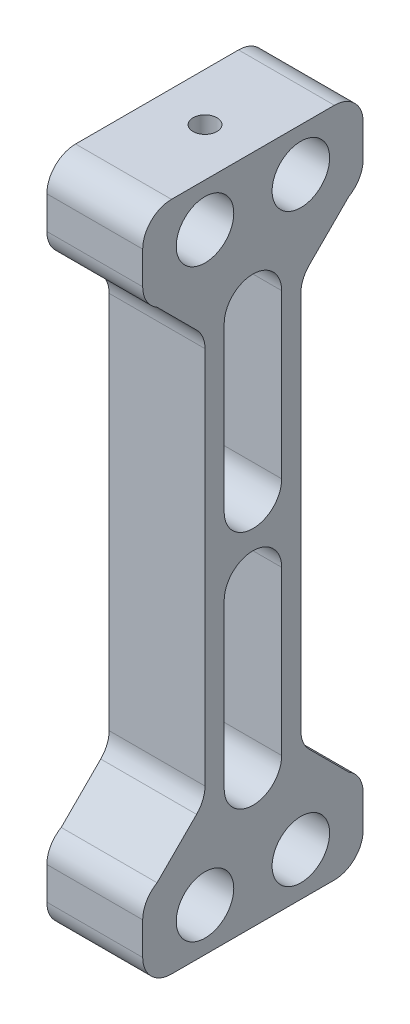
from build123d import *

# Parameters (mm, degrees)
SKETCH1_R                       = 3
BOSS_EXTRUDE1_DEPTH             = 10
CHAMFER1_SIZE                   = 5
FILLET1_R                       = 3
M3_TAPPED_HOLE3_D               = 2.5
M3_TAPPED_HOLE3_DEPTH           = 7.5
M3_TAPPED_HOLE3_TIP             = 0.751075774
M3_TAPPED_HOLE3_ON_FACE_2_D     = 2.5
M3_TAPPED_HOLE3_ON_FACE_2_DEPTH = 7.5
M3_TAPPED_HOLE3_ON_FACE_2_TIP   = 0.751075774


with BuildPart() as part:
    # Sketch1 → Boss-Extrude1 (new body)
    with BuildSketch(Plane(origin=(0, 0, 0), x_dir=(0, 0, -1), z_dir=(1, 0, 0))):
        Polygon((-16.5, 65.5), (-16.5, 56.5), (-10, 56.5), (-10, 4.5), (-16.5, 4.5), (-16.5, -4.5), (6.5, -4.5), (6.5, 4.5), (0, 4.5), (0, 56.5), (6.5, 56.5), (6.5, 65.5), align=None)
        with Locations((-10, 0)):
            Circle(SKETCH1_R, mode=Mode.SUBTRACT)
        with BuildLine():
            ThreePointArc((-8, 26.5), (-5, 29.5), (-2, 26.5))
            Line((-2, 26.5), (-2, 9.5))
            ThreePointArc((-2, 9.5), (-5, 6.5), (-8, 9.5))
            Line((-8, 9.5), (-8, 26.5))
        make_face(mode=Mode.SUBTRACT)
        Circle(SKETCH1_R, mode=Mode.SUBTRACT)
        with BuildLine():
            Line((-2, 51.5), (-2, 34.5))
            ThreePointArc((-2, 34.5), (-5, 31.5), (-8, 34.5))
            Line((-8, 34.5), (-8, 51.5))
            ThreePointArc((-8, 51.5), (-5, 54.5), (-2, 51.5))
        make_face(mode=Mode.SUBTRACT)
        with Locations((-10, 61)):
            Circle(SKETCH1_R, mode=Mode.SUBTRACT)
        with Locations((0, 61)):
            Circle(SKETCH1_R, mode=Mode.SUBTRACT)
    extrude(amount=BOSS_EXTRUDE1_DEPTH)

    # Chamfer1
    chamfer1_edges = [part.edges().sort_by_distance(p)[0] for p in [
        (5, 4.5, 10),
        (5, 56.5, 10),
        (5, 56.5, 0),
        (5, 4.5, 0),
    ]]
    chamfer(chamfer1_edges, length=CHAMFER1_SIZE)

    # Fillet1
    # the kernel refuses this fillet: 3 mm, written as the material it adds along each edge
    with BuildSketch(Plane(origin=(0, 51.5, 0), x_dir=(0, 0.7071067811865468, -0.7071067811865482), z_dir=(1, 0, 0)), Plane(origin=(0, 9.5, 0), x_dir=(0, 1, 0), z_dir=(1, 0, 0))) as fillet1_piece_1:
        with BuildLine():
            CenterArc((FILLET1_R * 0.414213562373, -FILLET1_R), FILLET1_R, 90, 45)
            Line((-FILLET1_R * 0.292893218813, -FILLET1_R * 0.292893218813), (0, 0))
            Line((0, 0), (FILLET1_R * 0.414213562373, 0))
        make_face()
    extrude(amount=10)
    with BuildSketch(Plane(origin=(0, 9.5, 10), x_dir=(0, 1, 0), z_dir=(1, 0, 0)), Plane(origin=(0, 51.5, 10), x_dir=(0, 0.7071067811865468, 0.7071067811865482), z_dir=(1, 0, 0))) as fillet1_piece_2:
        with BuildLine():
            CenterArc((FILLET1_R * 0.414213562373, FILLET1_R), FILLET1_R, 225, 45)
            Line((-FILLET1_R * 0.292893218813, FILLET1_R * 0.292893218813), (0, 0))
            Line((0, 0), (FILLET1_R * 0.414213562373, 0))
        make_face()
    extrude(amount=10)
    # the kernel refuses this fillet: 3 mm, written as the material it takes off along each edge
    with BuildSketch(Plane(origin=(-6.495190528, 56.5, 16.5), x_dir=(0, 1, 0), z_dir=(1, 0, 0))) as fillet1_2_piece_1:
        with BuildLine():
            CenterArc((2.598076211, -3), FILLET1_R, 90, 60)
            Line((0, -1.5), (0, 0))
            Line((0, 0), (2.598076211, 0))
        make_face()
    extrude(amount=22.990381057, mode=Mode.SUBTRACT)
    with BuildSketch(Plane(origin=(-7.5, 65.5, 16.5), x_dir=(0, 0, -1), z_dir=(1, 0, 0)), Plane(origin=(-7.5, 65.5, -6.5), x_dir=(0, -1, 0), z_dir=(1, 0, 0))) as fillet1_2_piece_2:
        with BuildLine():
            CenterArc((FILLET1_R, -FILLET1_R), FILLET1_R, 90, 90)
            Line((0, -FILLET1_R), (0, 0))
            Line((0, 0), (FILLET1_R, 0))
        make_face()
    extrude(amount=25, mode=Mode.SUBTRACT)
    with BuildSketch(Plane(origin=(-6.495190528, 56.5, -6.5), x_dir=(0, 0, 1), z_dir=(1, 0, 0))) as fillet1_2_piece_3:
        with BuildLine():
            CenterArc((3, -2.598076211), FILLET1_R, 120, 60)
            Line((0, -2.598076211), (0, 0))
            Line((0, 0), (1.5, 0))
        make_face()
    extrude(amount=22.990381057, mode=Mode.SUBTRACT)
    with BuildSketch(Plane(origin=(-6.495190528, 4.5, -6.5), x_dir=(0, 0, 1), z_dir=(1, 0, 0))) as fillet1_2_piece_4:
        with BuildLine():
            CenterArc((3, 2.598076211), FILLET1_R, 180, 60)
            Line((0, 2.598076211), (0, 0))
            Line((0, 0), (1.5, 0))
        make_face()
    extrude(amount=22.990381057, mode=Mode.SUBTRACT)
    with BuildSketch(Plane(origin=(-7.5, -4.5, -6.5), x_dir=(0, 1, 0), z_dir=(1, 0, 0)), Plane(origin=(-7.5, -4.5, 16.5), x_dir=(0, 0, -1), z_dir=(1, 0, 0))) as fillet1_2_piece_5:
        with BuildLine():
            CenterArc((FILLET1_R, FILLET1_R), FILLET1_R, 180, 90)
            Line((0, FILLET1_R), (0, 0))
            Line((0, 0), (FILLET1_R, 0))
        make_face()
    extrude(amount=25, mode=Mode.SUBTRACT)
    with BuildSketch(Plane(origin=(-6.495190528, 4.5, 16.5), x_dir=(0, -1, 0), z_dir=(1, 0, 0))) as fillet1_2_piece_6:
        with BuildLine():
            CenterArc((2.598076211, 3), FILLET1_R, 210, 60)
            Line((0, 1.5), (0, 0))
            Line((0, 0), (2.598076211, 0))
        make_face()
    extrude(amount=22.990381057, mode=Mode.SUBTRACT)

    # M3 Tapped Hole3
    with Locations(Plane(origin=(5, 65.5, 5), x_dir=(0, 0, 1), z_dir=(0, 1, 0))):
        with Locations((0, 0)):
            Hole(M3_TAPPED_HOLE3_D / 2, depth=M3_TAPPED_HOLE3_DEPTH)
            with Locations((0, 0, -(M3_TAPPED_HOLE3_DEPTH + M3_TAPPED_HOLE3_TIP / 2))):  # 118° drill point
                Cone(0, M3_TAPPED_HOLE3_D / 2, M3_TAPPED_HOLE3_TIP, mode=Mode.SUBTRACT)

    # M3 Tapped Hole3 on face 2
    with Locations(Plane(origin=(5, -4.5, 5), x_dir=(0, 0, -1), z_dir=(0, -1, 0))):
        with Locations((0, 0)):
            Hole(M3_TAPPED_HOLE3_ON_FACE_2_D / 2, depth=M3_TAPPED_HOLE3_ON_FACE_2_DEPTH)
            with Locations((0, 0, -(M3_TAPPED_HOLE3_ON_FACE_2_DEPTH + M3_TAPPED_HOLE3_ON_FACE_2_TIP / 2))):  # 118° drill point
                Cone(0, M3_TAPPED_HOLE3_ON_FACE_2_D / 2, M3_TAPPED_HOLE3_ON_FACE_2_TIP, mode=Mode.SUBTRACT)


solid = part.part
